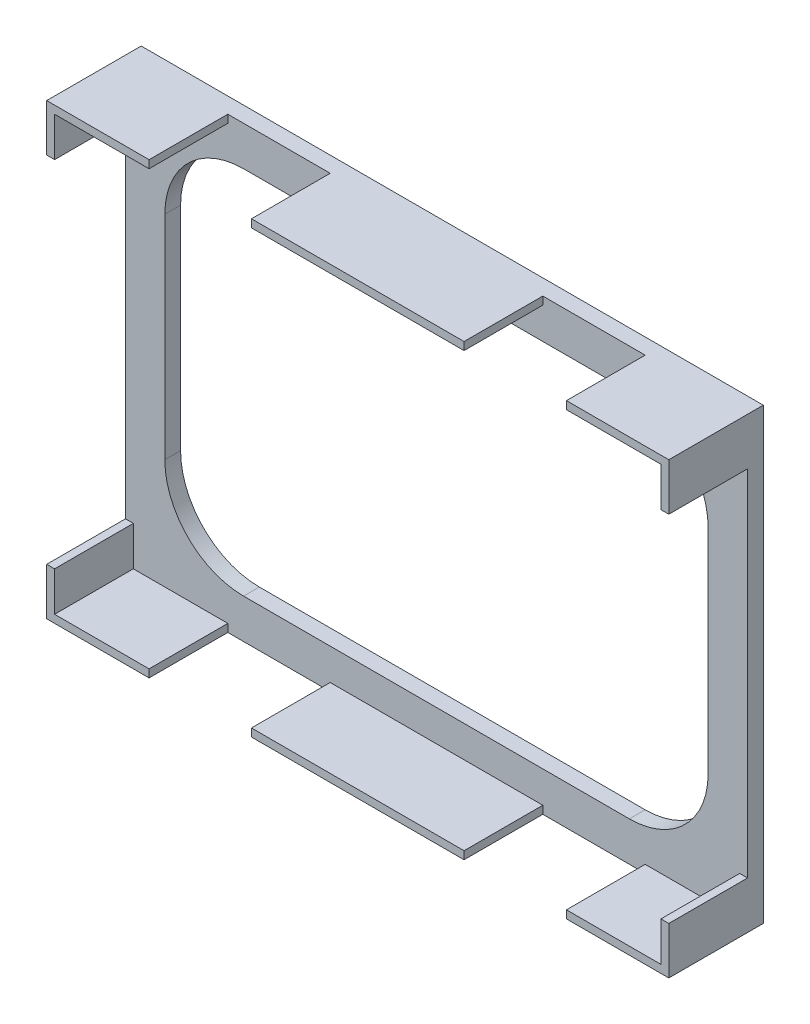
from build123d import *

# Parameters (mm, degrees)
SKETCH1_W           = 79
SKETCH1_H           = 57
BOSS_EXTRUDE1_DEPTH = 12
SKETCH2_W           = 77
SKETCH2_H           = 55
CUT_EXTRUDE1_DEPTH  = 10
SKETCH3_W           = 10
SKETCH3_H           = 45
CUT_EXTRUDE3_DEPTH  = 100
SKETCH6_W           = 13
SKETCH6_H           = 10
CUT_EXTRUDE5_DEPTH  = 100
SKETCH7_W           = 69
SKETCH7_H           = 47
CUT_EXTRUDE7_DEPTH  = 10
FILLET1_R           = 10
FILLET2_R           = 10
FILLET3_R           = 10
FILLET4_R           = 10


with BuildPart() as part:
    # Sketch1 → Boss-Extrude1 (new body)
    with BuildSketch(Plane.XY):
        with Locations((39.5, 28.5)):
            Rectangle(SKETCH1_W, SKETCH1_H)
    extrude(amount=BOSS_EXTRUDE1_DEPTH)

    # Sketch2 → Cut-Extrude1 (cut)
    with BuildSketch(Plane.XY.offset(12)):
        with Locations((39.5, 28.5)):
            Rectangle(SKETCH2_W, SKETCH2_H)
    extrude(amount=-CUT_EXTRUDE1_DEPTH, mode=Mode.SUBTRACT)

    # Sketch3 → Cut-Extrude3 (cut)
    with BuildSketch(Plane(origin=(79, 0, 0), x_dir=(0, 0, -1), z_dir=(1, 0, 0))):
        with Locations((-7, 28.5)):
            Rectangle(SKETCH3_W, SKETCH3_H)
    extrude(amount=-CUT_EXTRUDE3_DEPTH, mode=Mode.SUBTRACT)

    # Sketch6 → Cut-Extrude5 (cut)
    with BuildSketch(Plane.XZ):
        with Locations((19.5, 7)):
            Rectangle(SKETCH6_W, SKETCH6_H)
        with Locations((59.5, 7)):
            Rectangle(SKETCH6_W, SKETCH6_H)
    extrude(amount=-CUT_EXTRUDE5_DEPTH, mode=Mode.SUBTRACT)

    # Sketch7 → Cut-Extrude7 (cut)
    with BuildSketch(Plane.XY.offset(2)):
        with Locations((39.5, 28.5)):
            Rectangle(SKETCH7_W, SKETCH7_H)
    extrude(amount=-CUT_EXTRUDE7_DEPTH, mode=Mode.SUBTRACT)

    # Fillet1
    fillet1_edges = [part.edges().sort_by_distance(p)[0] for p in [
        (5, 52, 1),
    ]]
    fillet(fillet1_edges, radius=FILLET1_R)

    # Fillet2
    fillet2_edges = [part.edges().sort_by_distance(p)[0] for p in [
        (5, 5, 1),
    ]]
    fillet(fillet2_edges, radius=FILLET2_R)

    # Fillet3
    fillet3_edges = [part.edges().sort_by_distance(p)[0] for p in [
        (74, 5, 1),
    ]]
    fillet(fillet3_edges, radius=FILLET3_R)

    # Fillet4
    fillet4_edges = [part.edges().sort_by_distance(p)[0] for p in [
        (74, 52, 1),
    ]]
    fillet(fillet4_edges, radius=FILLET4_R)


solid = part.part
